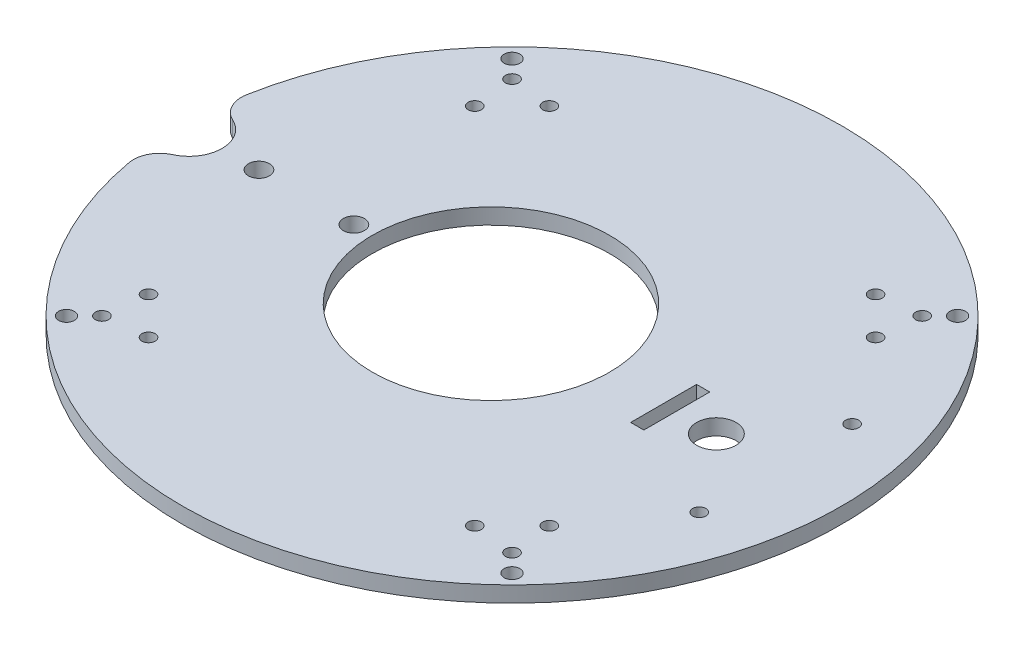
from build123d import *

# Parameters (mm, degrees)
SKETCH1_R                    = 125
SKETCH1_R_2                  = 4
BOSS_EXTRUDE1_DEPTH          = 6
SKETCH2_R                    = 2.5
BYPASS_HOLE_FOR_SPRING_DEPTH = 177.878489365
SKETCH5_R                    = 45
BYPASS_HOLE_DEPTH            = 10
SKETCH7_R                    = 2.5
CUT_EXTRUDE3_DEPTH           = 177.878489365
SKETCH10_R                   = 7.5
WIRING_PASS_THROUGH_DEPTH    = 6
SKETCH11_W                   = 25
SKETCH11_H                   = 25
CUT_EXTRUDE7_DEPTH           = 10
FILLET2_R                    = 12.5
FILLET3_R                    = 10
SKETCH13_R                   = 2.5
SKETCH13_R_2                 = 3
CUT_EXTRUDE9_DEPTH           = 10
SKETCH14_W                   = 5
SKETCH14_H                   = 25
CUT_EXTRUDE10_DEPTH          = 6


with BuildPart() as part:
    # Sketch1 → Boss-Extrude1 (new body)
    with BuildSketch(Plane(origin=(0, 0, 0), x_dir=(1, 0, 0), z_dir=(0, 1, 0))):
        with Locations(Location((0, 0, 0), (0, 0, 270))):
            Circle(SKETCH1_R)
        with Locations(Location((-96, 0, 0), (0, 0, 270))):
            Circle(SKETCH1_R_2, mode=Mode.SUBTRACT)
        with Locations(Location((-60, 0, 0), (0, 0, 270))):
            Circle(SKETCH1_R_2, mode=Mode.SUBTRACT)
    extrude(amount=BOSS_EXTRUDE1_DEPTH)

    # Sketch2 → Bypass Hole for Spring (cut, through all)
    with BuildSketch(Plane(origin=(0, 0, 0), x_dir=(1, 0, 0), z_dir=(0, 1, 0))):
        with Locations(Location((-77.781745931, 77.781745931, 0), (0, 0, 270))):
            Circle(SKETCH2_R)
        with Locations(Location((77.781745931, 77.781745931, 0), (0, 0, 270))):
            Circle(SKETCH2_R)
        with Locations(Location((77.781745931, -77.781745931, 0), (0, 0, 270))):
            Circle(SKETCH2_R)
        with Locations(Location((-77.781745931, -77.781745931, 0), (0, 0, 270))):
            Circle(SKETCH2_R)
    extrude(amount=BYPASS_HOLE_FOR_SPRING_DEPTH, mode=Mode.SUBTRACT)

    # Sketch5 → Bypass Hole (cut)
    with BuildSketch(Plane(origin=(0, 0, 0), x_dir=(1, 0, 0), z_dir=(0, 1, 0))):
        with Locations(Location((-8, 0, 0), (0, 0, 270))):
            Circle(SKETCH5_R)
    extrude(amount=BYPASS_HOLE_DEPTH, mode=Mode.SUBTRACT)

    # Sketch7 → Cut-Extrude3 (cut, through all)
    with BuildSketch(Plane(origin=(0, 0, 0), x_dir=(1, 0, 0), z_dir=(0, 1, 0))):
        with Locations(Location((100, 29, 0), (0, 0, 270))):
            Circle(SKETCH7_R)
        with Locations(Location((100, -29, 0), (0, 0, 90))):
            Circle(SKETCH7_R)
    extrude(amount=CUT_EXTRUDE3_DEPTH, mode=Mode.SUBTRACT)

    # Sketch10 → Wiring Pass Through (cut)
    with BuildSketch(Plane(origin=(0, 0, 0), x_dir=(1, 0, 0), z_dir=(0, 1, 0))):
        with Locations(Location((77.5, 0, 0), (0, 0, 270))):
            Circle(SKETCH10_R)
    extrude(amount=WIRING_PASS_THROUGH_DEPTH, mode=Mode.SUBTRACT)

    # Sketch11 → Cut-Extrude7 (cut)
    with BuildSketch(Plane(origin=(0, 0, 0), x_dir=(1, 0, 0), z_dir=(0, 1, 0))):
        with Locations((-122.5, 0)):
            Rectangle(SKETCH11_W, SKETCH11_H)
    extrude(amount=CUT_EXTRUDE7_DEPTH, mode=Mode.SUBTRACT)

    # Fillet2
    fillet2_edges = [part.edges().sort_by_distance(p)[0] for p in [
        (-110, 3, 12.5),
        (-110, 3, -12.5),
    ]]
    fillet(fillet2_edges, radius=FILLET2_R - 0.0001)  # a hair under: the kernel refuses the full size

    # Fillet3
    fillet3_edges = [part.edges().sort_by_distance(p)[0] for p in [
        (-124.373429638, 3, 12.5),
        (-124.373429638, 3, -12.5),
    ]]
    fillet(fillet3_edges, radius=FILLET3_R)

    # Sketch13 → Cut-Extrude9 (cut)
    with BuildSketch(Plane(origin=(0, 0, 0), x_dir=(1, 0, 0), z_dir=(0, 1, 0))):
        with Locations(Location((76.013978978, -61.871843354, 0), (0, 0, 270))):
            Circle(SKETCH13_R)
        with Locations(Location((61.871843354, -76.013978977, 0), (0, 0, 270))):
            Circle(SKETCH13_R)
        with Locations(Location((84.499260352, -84.499260352, 0), (0, 0, 270))):
            Circle(SKETCH13_R_2)
        with Locations(Location((-61.871843354, -76.013978978, 0), (0, 0, 270))):
            Circle(SKETCH13_R)
        with Locations(Location((-76.013978977, -61.871843354, 0), (0, 0, 270))):
            Circle(SKETCH13_R)
        with Locations(Location((-84.499260352, -84.499260352, 0), (0, 0, 270))):
            Circle(SKETCH13_R_2)
        with Locations(Location((-76.013978978, 61.871843354, 0), (0, 0, 270))):
            Circle(SKETCH13_R)
        with Locations(Location((-61.871843354, 76.013978977, 0), (0, 0, 270))):
            Circle(SKETCH13_R)
        with Locations(Location((-84.499260352, 84.499260352, 0), (0, 0, 270))):
            Circle(SKETCH13_R_2)
        with Locations(Location((61.871843354, 76.013978978, 0), (0, 0, 270))):
            Circle(SKETCH13_R)
        with Locations(Location((76.013978977, 61.871843354, 0), (0, 0, 270))):
            Circle(SKETCH13_R)
        with Locations(Location((84.499260352, 84.499260352, 0), (0, 0, 270))):
            Circle(SKETCH13_R_2)
    extrude(amount=CUT_EXTRUDE9_DEPTH, mode=Mode.SUBTRACT)

    # Sketch14 → Cut-Extrude10 (cut)
    with BuildSketch(Plane(origin=(0, 0, 0), x_dir=(1, 0, 0), z_dir=(0, 1, 0))):
        with Locations((60, 0)):
            Rectangle(SKETCH14_W, SKETCH14_H)
    extrude(amount=CUT_EXTRUDE10_DEPTH, mode=Mode.SUBTRACT)


solid = part.part
